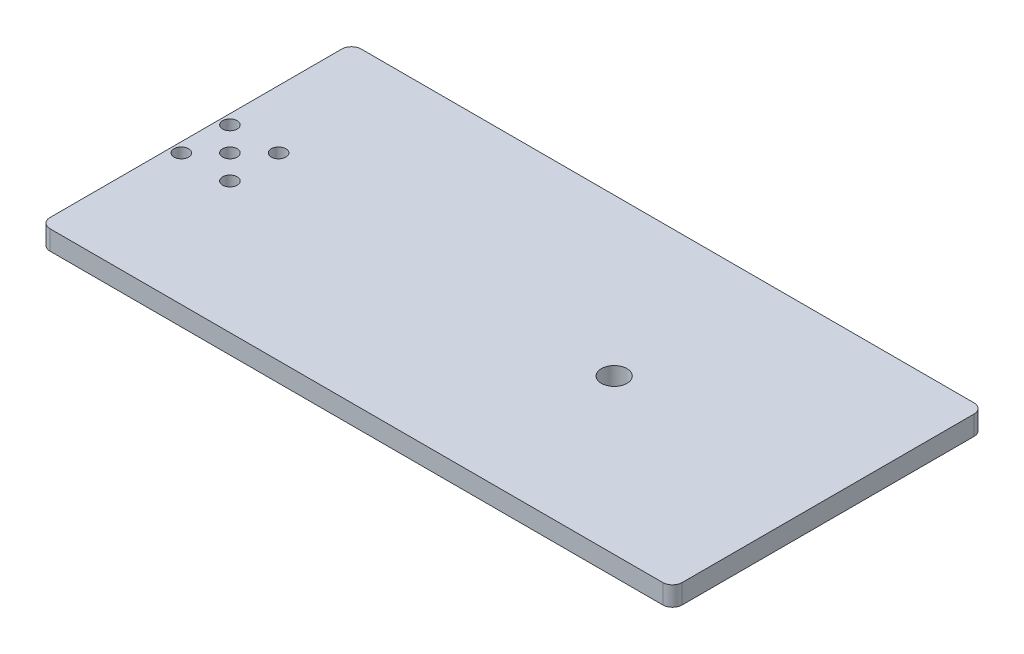
from build123d import *

# Parameters (mm, degrees)
BOSS_EXTRUDE1_DEPTH = 2
CUT_EXTRUDE2_REACH  = 74.478
SKETCH8_R           = 0.75
CUT_EXTRUDE3_REACH  = 74.478
SKETCH9_R           = 1.316483274


with BuildPart() as part:
    # Sketch1 → Boss-Extrude1 (new body)
    with BuildSketch(Plane(origin=(0, 0, 0), x_dir=(1, 0, 0), z_dir=(0, 1, 0))):
        with BuildLine():
            Line((1, 0), (64, 0))
            ThreePointArc((64, 0), (64.707106781, 0.292893219), (65, 1))
            Line((65, 1), (65, 31))
            ThreePointArc((65, 31), (64.707106781, 31.707106781), (64, 32))
            Line((64, 32), (1, 32))
            ThreePointArc((1, 32), (0.292893219, 31.707106781), (0, 31))
            Line((0, 31), (0, 1))
            ThreePointArc((0, 1), (0.292893219, 0.292893219), (1, 0))
        make_face()
    extrude(amount=BOSS_EXTRUDE1_DEPTH)

    # Sketch8 → Cut-Extrude2 (cut, up to next)
    with BuildSketch(Plane(origin=(0, 2, 0), x_dir=(1, 0, 0), z_dir=(0, 1, 0)), mode=Mode.PRIVATE) as cut_extrude2_sk1:
        with Locations((3.5, 16)):
            Circle(SKETCH8_R)
    cut_extrude2_tool1 = extrude(cut_extrude2_sk1.sketch, amount=-CUT_EXTRUDE2_REACH, mode=Mode.PRIVATE) & part.part
    # Sketch8 → Cut-Extrude2 (cut, up to next)
    with BuildSketch(Plane(origin=(0, 2, 0), x_dir=(1, 0, 0), z_dir=(0, 1, 0)), mode=Mode.PRIVATE) as cut_extrude2_sk2:
        with Locations((6, 18.5)):
            Circle(SKETCH8_R)
    cut_extrude2_tool2 = extrude(cut_extrude2_sk2.sketch, amount=-CUT_EXTRUDE2_REACH, mode=Mode.PRIVATE) & part.part
    # Sketch8 → Cut-Extrude2 (cut, up to next)
    with BuildSketch(Plane(origin=(0, 2, 0), x_dir=(1, 0, 0), z_dir=(0, 1, 0)), mode=Mode.PRIVATE) as cut_extrude2_sk3:
        with Locations((6, 13.5)):
            Circle(SKETCH8_R)
    cut_extrude2_tool3 = extrude(cut_extrude2_sk3.sketch, amount=-CUT_EXTRUDE2_REACH, mode=Mode.PRIVATE) & part.part
    # Sketch8 → Cut-Extrude2 (cut, up to next)
    with BuildSketch(Plane(origin=(0, 2, 0), x_dir=(1, 0, 0), z_dir=(0, 1, 0)), mode=Mode.PRIVATE) as cut_extrude2_sk4:
        with Locations((1, 13.499992953)):
            Circle(SKETCH8_R)
    cut_extrude2_tool4 = extrude(cut_extrude2_sk4.sketch, amount=-CUT_EXTRUDE2_REACH, mode=Mode.PRIVATE) & part.part
    # Sketch8 → Cut-Extrude2 (cut, up to next)
    with BuildSketch(Plane(origin=(0, 2, 0), x_dir=(1, 0, 0), z_dir=(0, 1, 0)), mode=Mode.PRIVATE) as cut_extrude2_sk5:
        with Locations((1, 18.499992953)):
            Circle(SKETCH8_R)
    cut_extrude2_tool5 = extrude(cut_extrude2_sk5.sketch, amount=-CUT_EXTRUDE2_REACH, mode=Mode.PRIVATE) & part.part
    add(cut_extrude2_tool1.solids().sort_by_distance((3.5, 2, -16))[0], mode=Mode.SUBTRACT)
    add(cut_extrude2_tool2.solids().sort_by_distance((6, 2, -18.5))[0], mode=Mode.SUBTRACT)
    add(cut_extrude2_tool3.solids().sort_by_distance((6, 2, -13.5))[0], mode=Mode.SUBTRACT)
    add(cut_extrude2_tool4.solids().sort_by_distance((1, 2, -13.499993))[0], mode=Mode.SUBTRACT)
    add(cut_extrude2_tool5.solids().sort_by_distance((1, 2, -18.499993))[0], mode=Mode.SUBTRACT)

    # Sketch9 → Cut-Extrude3 (cut, up to next)
    with BuildSketch(Plane(origin=(0, 2, 0), x_dir=(1, 0, 0), z_dir=(0, 1, 0)), mode=Mode.PRIVATE) as cut_extrude3_sk1:
        with Locations((43.114982321, 15.890924109)):
            Circle(SKETCH9_R)
    cut_extrude3_tool1 = extrude(cut_extrude3_sk1.sketch, amount=-CUT_EXTRUDE3_REACH, mode=Mode.PRIVATE) & part.part
    add(cut_extrude3_tool1.solids().sort_by_distance((43.114982, 2, -15.890924))[0], mode=Mode.SUBTRACT)


solid = part.part
